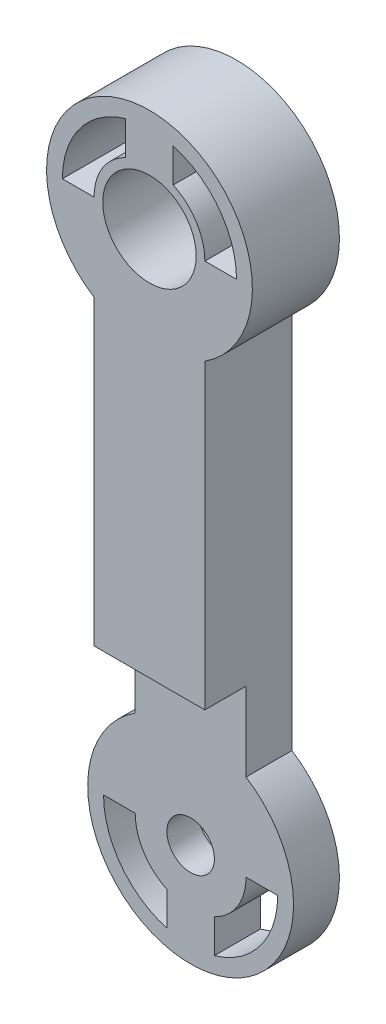
from build123d import *
from build123d.topology import SkipClean

# Parameters (mm, degrees)
SKETCH1_R               = 2.95
BOSS_EXTRUDE1_DEPTH     = 3.7
CUT_EXTRUDE1_DEPTH      = 10
CUT_EXTRUDE1_DEPTH_BACK = 10
SKETCH2_W               = 0.6
SKETCH2_H               = 16.95
SKETCH3_R               = 2.95
SKETCH3_R_2             = 1.5
BOSS_EXTRUDE2_DEPTH     = 3.1
SKETCH4_R               = 2.5
CUT_EXTRUDE2_DEPTH      = 1.5
SKETCH5_R               = 1.5
BOSS_EXTRUDE3_DEPTH     = 0.4
SKETCH6_R               = 2.95
BOSS_EXTRUDE4_DEPTH     = 2.4
SKETCH7_W               = 22.104564564
SKETCH7_H               = 50.546801486
CUT_EXTRUDE3_DEPTH      = 0.6


with BuildPart() as part:
    # Sketch1 → Boss-Extrude1 (new body)
    with BuildSketch(Plane.XY):
        with BuildLine():
            Line((-3.5, -5.477225575), (-3.5, -29.522774425))
            ThreePointArc((-3.5, -29.522774425), (0, -41.5), (3.5, -29.522774425))
            Line((3.5, -29.522774425), (3.5, -5.477225575))
            ThreePointArc((3.5, -5.477225575), (0, 6.5), (-3.5, -5.477225575))
        make_face()
        with BuildLine():
            Line((-3.5, 0), (-5.5, 0))
            ThreePointArc((-5.5, 0), (-4.387482194, 3.31662479), (-1.5, 5.291502622))
            Line((-1.5, 5.291502622), (-1.5, 3.16227766))
            ThreePointArc((-1.5, 3.16227766), (-2.958039892, 1.870828693), (-3.5, 0))
        make_face(mode=Mode.SUBTRACT)
        with BuildLine():
            ThreePointArc((1.5, 5.291502622), (4.387482194, 3.31662479), (5.5, 0))
            Line((5.5, 0), (3.5, 0))
            ThreePointArc((3.5, 0), (2.958039892, 1.870828693), (1.5, 3.16227766))
            Line((1.5, 3.16227766), (1.5, 5.291502622))
        make_face(mode=Mode.SUBTRACT)
        Circle(SKETCH1_R, mode=Mode.SUBTRACT)
        with BuildLine():
            ThreePointArc((-1.5, -40.291502622), (-4.387482194, -38.31662479), (-5.5, -35))
            Line((-5.5, -35), (-3.5, -35))
            ThreePointArc((-3.5, -35), (-2.958039892, -36.870828693), (-1.5, -38.16227766))
            Line((-1.5, -38.16227766), (-1.5, -40.291502622))
        make_face(mode=Mode.SUBTRACT)
        with BuildLine():
            ThreePointArc((5.5, -35), (4.387482194, -38.31662479), (1.5, -40.291502622))
            Line((1.5, -40.291502622), (1.5, -38.16227766))
            ThreePointArc((1.5, -38.16227766), (2.958039892, -36.870828693), (3.5, -35))
            Line((3.5, -35), (5.5, -35))
        make_face(mode=Mode.SUBTRACT)
        with Locations((0, -35)):
            Circle(SKETCH1_R, mode=Mode.SUBTRACT)
    extrude(amount=BOSS_EXTRUDE1_DEPTH)

    # Sketch2 → Cut-Extrude1 (cut, two sides: drawn at the far end of the back side and taken through both)
    with BuildSketch(Plane(origin=(0, 0, 0), x_dir=(0, 0, -1), z_dir=(1, 0, 0)).offset(-CUT_EXTRUDE1_DEPTH_BACK)):
        with Locations((-3.4, -33.025)):
            Rectangle(SKETCH2_W, SKETCH2_H)
    extrude(amount=CUT_EXTRUDE1_DEPTH + CUT_EXTRUDE1_DEPTH_BACK, mode=Mode.SUBTRACT)

    # Sketch3 → Boss-Extrude2 (add)
    with BuildSketch(Plane(origin=(0, 0, 0), x_dir=(-1, 0, 0), z_dir=(0, 0, -1))):
        with Locations((0, -35)):
            Circle(SKETCH3_R)
        with Locations((0, -35)):
            Circle(SKETCH3_R_2, mode=Mode.SUBTRACT)
    extrude(amount=-BOSS_EXTRUDE2_DEPTH)

    # Sketch4 → Cut-Extrude2 (cut)
    with BuildSketch(Plane(origin=(0, 0, 0), x_dir=(-1, 0, 0), z_dir=(0, 0, -1))):
        with Locations((0, -35)):
            Circle(SKETCH4_R)
    extrude(amount=-CUT_EXTRUDE2_DEPTH, mode=Mode.SUBTRACT)

    # Sketch5 → Boss-Extrude3 (add)
    with SkipClean():  # the faces are left unmerged after this step: merging them gives an invalid solid
        with BuildSketch(Plane.XY.offset(3.1)):
            with BuildLine():
                Line((3.5, -24.55), (-3.5, -24.55))
                Line((-3.5, -24.55), (-3.5, -29.522774425))
                ThreePointArc((-3.5, -29.522774425), (0, -41.5), (3.5, -29.522774425))
                Line((3.5, -29.522774425), (3.5, -24.55))
            make_face()
            with BuildLine():
                Line((-5.5, -35), (-3.5, -35))
                ThreePointArc((-3.5, -35), (-2.958039892, -36.870828693), (-1.5, -38.16227766))
                Line((-1.5, -38.16227766), (-1.5, -40.291502622))
                ThreePointArc((-1.5, -40.291502622), (-4.387482194, -38.31662479), (-5.5, -35))
            make_face(mode=Mode.SUBTRACT)
            with BuildLine():
                ThreePointArc((5.5, -35), (4.387482194, -38.31662479), (1.5, -40.291502622))
                Line((1.5, -40.291502622), (1.5, -38.16227766))
                ThreePointArc((1.5, -38.16227766), (2.958039892, -36.870828693), (3.5, -35))
                Line((3.5, -35), (5.5, -35))
            make_face(mode=Mode.SUBTRACT)
            with Locations((0, -35)):
                Circle(SKETCH5_R, mode=Mode.SUBTRACT)
        extrude(amount=BOSS_EXTRUDE3_DEPTH)

    # Sketch6 → Boss-Extrude4 (add)
    with SkipClean():  # the faces are left unmerged after this step: merging them gives an invalid solid
        with BuildSketch(Plane.XY.offset(3.7)):
            with BuildLine():
                Line((-3.5, -5.477225575), (-3.5, -24.55))
                Line((-3.5, -24.55), (3.5, -24.55))
                Line((3.5, -24.55), (3.5, -5.477225575))
                ThreePointArc((3.5, -5.477225575), (0, 6.5), (-3.5, -5.477225575))
            make_face()
            Circle(SKETCH6_R, mode=Mode.SUBTRACT)
            with BuildLine():
                Line((-1.5, 5.291502622), (-1.5, 3.16227766))
                ThreePointArc((-1.5, 3.16227766), (-2.958039892, 1.870828693), (-3.5, 0))
                Line((-3.5, 0), (-5.5, 0))
                ThreePointArc((-5.5, 0), (-4.387482194, 3.31662479), (-1.5, 5.291502622))
            make_face(mode=Mode.SUBTRACT)
            with BuildLine():
                Line((1.5, 5.291502622), (1.5, 3.16227766))
                ThreePointArc((1.5, 3.16227766), (2.958039892, 1.870828693), (3.5, 0))
                Line((3.5, 0), (5.5, 0))
                ThreePointArc((5.5, 0), (4.387482194, 3.31662479), (1.5, 5.291502622))
            make_face(mode=Mode.SUBTRACT)
        extrude(amount=BOSS_EXTRUDE4_DEPTH)

    # Sketch7 → Cut-Extrude3 (cut)
    with SkipClean():  # the faces are left unmerged after this step: merging them gives an invalid solid
        with BuildSketch(Plane.XY):
            with Locations((0.952758093, -17.453923436)):
                Rectangle(SKETCH7_W, SKETCH7_H)
        extrude(amount=CUT_EXTRUDE3_DEPTH, mode=Mode.SUBTRACT)


solid = part.part
